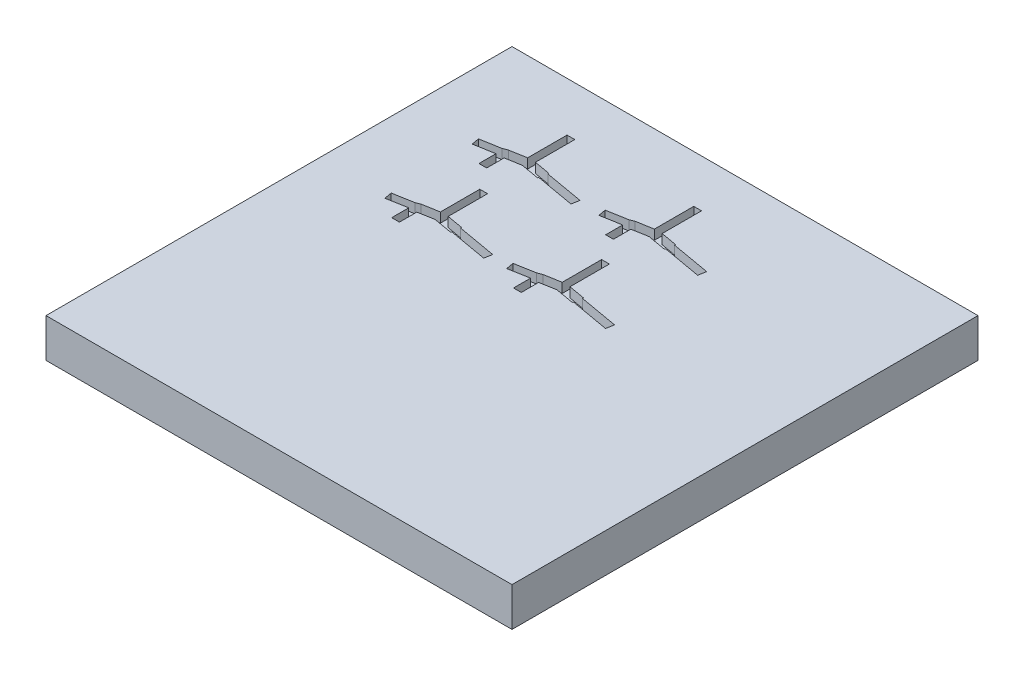
from build123d import *

# Parameters (mm, degrees)
SKETCH2_W               = 304.8
SKETCH2_H               = 304.8
BOSS_EXTRUDE1_DEPTH     = 25.4
CUT_EXTRUDE_THIN1_DEPTH = 6.35
SKETCH4_W               = 5.08
SKETCH4_H               = 28.524718884
CUT_EXTRUDE_THIN3_DEPTH = 6.35
CUT_EXTRUDE1_START      = -6.35
CUT_EXTRUDE1_DEPTH      = 6.35
SKETCH_PATTERN1_START   = 19.05
SKETCH_PATTERN1_DEPTH   = 6.35


# Read off the part's stored shape, not the designer's step: Sketch-Pattern1
with BuildPart() as part:
    # Sketch2 → Boss-Extrude1 (new body)
    with BuildSketch(Plane(origin=(0, 0, 0), x_dir=(1, 0, 0), z_dir=(0, 1, 0))):
        with Locations((152.4, 152.4)):
            Rectangle(SKETCH2_W, SKETCH2_H)
    extrude(amount=BOSS_EXTRUDE1_DEPTH)

    # Sketch3 → Cut-Extrude-Thin1 (cut)
    with BuildSketch(Plane(origin=(0, 25.4, 0), x_dir=(1, 0, 0), z_dir=(0, 1, 0))):
        Polygon((58.541128736, 238.760939297), (70.689795772, 240.903077075), (82.838462808, 238.760939297), (83.941128736, 245.014468529), (70.689795772, 247.351036061), (57.438462808, 245.014468529), align=None)
    extrude(amount=-CUT_EXTRUDE_THIN1_DEPTH, mode=Mode.SUBTRACT)

    # Sketch4 → Cut-Extrude-Thin3 (cut)
    with BuildSketch(Plane(origin=(0, 25.4, 0), x_dir=(1, 0, 0), z_dir=(0, 1, 0))):
        Polygon((42.217765698, 236.527485876), (55.449795772, 238.860649788), (55.449795772, 227.718390038), (60.529795772, 227.718390038), (60.529795772, 244.914758038), (41.335632956, 241.530309262), align=None)
        with Locations((70.689795772, 258.38941601)):
            Rectangle(SKETCH4_W, SKETCH4_H)
        Polygon((82.948729401, 239.38629222), (108.484764207, 234.883600304), (109.36689695, 239.886423689), (83.830862143, 244.389115606), align=None)
    extrude(amount=-CUT_EXTRUDE_THIN3_DEPTH, mode=Mode.SUBTRACT)

    # Sketch6 → Cut-Extrude1 (cut)
    with BuildSketch(Plane(origin=(0, 25.4, 0), x_dir=(1, 0, 0), z_dir=(0, 1, 0)).offset(CUT_EXTRUDE1_START)):
        Polygon((57.438462808, 245.014468529), (54.521459745, 243.855326287), (57.548729401, 244.389115606), align=None)
    extrude(amount=CUT_EXTRUDE1_DEPTH, mode=Mode.SUBTRACT)

    # Sketch-Pattern1 outline → Sketch-Pattern1 (cut)
    with BuildSketch(Plane(origin=(0, 0, 0), x_dir=(1, 0, 0), z_dir=(0, 1, 0)).offset(SKETCH_PATTERN1_START)):
        Polygon((165.644408099, 185.179807617), (165.754674692, 185.80516054), (155.043341728, 187.693857541), (155.043341728, 213.442467463), (149.963341728, 213.442467463), (149.963341728, 187.693857541), (139.252008764, 185.80516054), (136.335005701, 184.646018299), (123.149178912, 182.321001273), (124.031311655, 177.318177888), (137.263341728, 179.651341799), (137.263341728, 168.509082049), (142.343341728, 168.509082049), (142.343341728, 179.902286963), (152.503341728, 181.693769087), (164.652008764, 179.551631308), (164.762275357, 180.176984232), (190.298310163, 175.674292315), (191.180442906, 180.6771157), align=None)
        Polygon((165.644408099, 245.46400238), (165.754674692, 246.089355303), (155.043341728, 247.978052304), (155.043341728, 273.726662226), (149.963341728, 273.726662226), (149.963341728, 247.978052304), (139.252008764, 246.089355303), (136.335005701, 244.930213062), (123.149178912, 242.605196036), (124.031311655, 237.60237265), (137.263341728, 239.935536562), (137.263341728, 228.793276812), (142.343341728, 228.793276812), (142.343341728, 240.186481725), (152.503341728, 241.977963849), (164.652008764, 239.835826071), (164.762275357, 240.461178994), (190.298310163, 235.958487078), (191.180442906, 240.961310463), align=None)
        Polygon((85.970773635, 185.179807617), (86.081040228, 185.80516054), (75.369707264, 187.693857541), (75.369707264, 213.442467463), (70.289707264, 213.442467463), (70.289707264, 187.693857541), (59.578374299, 185.80516054), (56.661371236, 184.646018299), (43.475544447, 182.321001273), (44.35767719, 177.318177888), (57.589707264, 179.651341799), (57.589707264, 168.509082049), (62.669707264, 168.509082049), (62.669707264, 179.902286963), (72.829707264, 181.693769087), (84.978374299, 179.551631308), (85.088640892, 180.176984232), (110.624675699, 175.674292315), (111.506808441, 180.6771157), align=None)
    extrude(amount=SKETCH_PATTERN1_DEPTH, mode=Mode.SUBTRACT)


solid = part.part
